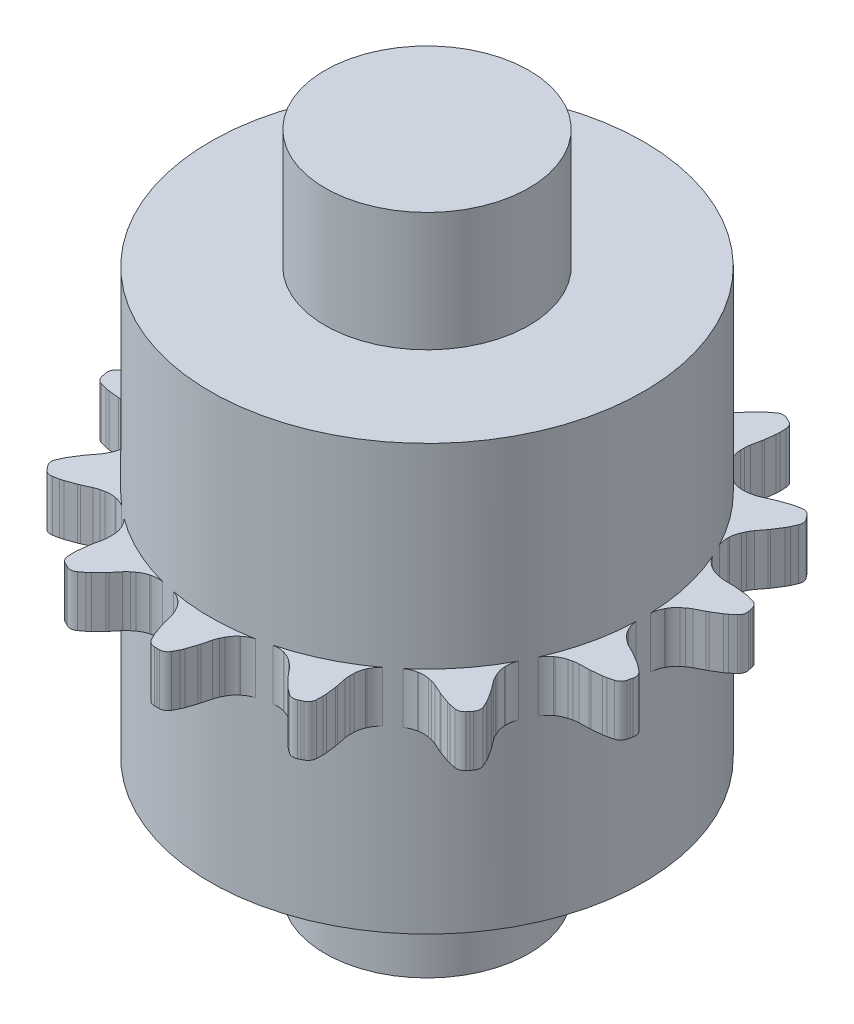
from build123d import *

# Parameters (mm, degrees)
BOSS_EXTRUDE1_DEPTH = 3


with BuildPart() as part:
    # Sketch1 → Revolve1 (revolve)
    with BuildSketch(Plane.XY):
        Polygon((12.74, 25), (12.74, 0), (6, 0), (6, -7), (0, -7), (0, 32), (6, 32), (6, 25), align=None)
    revolve(axis=Axis((0, 0, 0), (0, 1, 0)))

    # Sketch3 → Boss-Extrude1 (add)
    with BuildSketch(Plane(origin=(0, 10.5, 0), x_dir=(-1, 0, 0), z_dir=(0, -1, 0))):
        with BuildLine():
            ThreePointArc((-7.604112547, 10.22179399), (-5.527678836, 11.478343377), (-3.250633724, 12.318318895))
            ThreePointArc((-3.250633724, 12.318318895), (-3.575731316, 12.298335679), (-3.897478234, 12.348998229))
            Line((-3.897478234, 12.348998229), (-3.960120129, 12.365995683))
            ThreePointArc((-3.960120129, 12.365995683), (-4.23545706, 12.470675067), (-4.485027777, 12.627144414))
            Line((-4.485027777, 12.627144414), (-4.670486474, 12.77059005))
            ThreePointArc((-4.670486474, 12.77059005), (-4.793748693, 12.877113397), (-4.904731597, 12.996376103))
            Line((-4.904731597, 12.996376103), (-5.268560327, 13.432630355))
            ThreePointArc((-5.268560327, 13.432630355), (-5.308223076, 13.478285048), (-5.349693923, 13.522303833))
            Line((-5.349693923, 13.522303833), (-5.78239737, 13.963426694))
            ThreePointArc((-5.78239737, 13.963426694), (-5.86446704, 14.041021079), (-5.952142462, 14.112220374))
            Line((-5.952142462, 14.112220374), (-6.241887446, 14.329938852))
            ThreePointArc((-6.241887446, 14.329938852), (-6.494181544, 14.427894494), (-6.760558978, 14.380033419))
            Line((-6.760558978, 14.380033419), (-6.893895698, 14.315321924))
            Line((-6.893895698, 14.315321924), (-7.027623268, 14.251422035))
            ThreePointArc((-7.027623268, 14.251422035), (-7.231126177, 14.073000663), (-7.31184417, 13.814674851))
            Line((-7.31184417, 13.814674851), (-7.322278052, 13.45239785))
            ThreePointArc((-7.322278052, 13.45239785), (-7.321276933, 13.33945841), (-7.311780802, 13.226914451))
            Line((-7.311780802, 13.226914451), (-7.236683248, 12.613577668))
            ThreePointArc((-7.236683248, 12.613577668), (-7.228124627, 12.553709191), (-7.217159669, 12.49423437))
            Line((-7.217159669, 12.49423437), (-7.102925863, 11.937781537))
            ThreePointArc((-7.102925863, 11.937781537), (-7.078879234, 11.776652528), (-7.072448665, 11.613866024))
            Line((-7.072448665, 11.613866024), (-7.075929956, 11.379431684))
            ThreePointArc((-7.075929956, 11.379431684), (-7.109202092, 11.086752399), (-7.199030223, 10.806218789))
            Line((-7.199030223, 10.806218789), (-7.224797661, 10.746645644))
            ThreePointArc((-7.224797661, 10.746645644), (-7.385794006, 10.463506191), (-7.604112547, 10.22179399))
        make_face()
        with BuildLine():
            ThreePointArc((-1.846522974, 12.817115383), (-2.114425274, 12.631869247), (-2.415998476, 12.508818944))
            ThreePointArc((-2.415998476, 12.508818944), (0, 12.74), (2.415998476, 12.508818944))
            ThreePointArc((2.415998476, 12.508818944), (2.114425274, 12.631869247), (1.846522974, 12.817115383))
            Line((1.846522974, 12.817115383), (1.797459496, 12.85960886))
            ThreePointArc((1.797459496, 12.85960886), (1.594808175, 13.073385943), (1.437842233, 13.322644629))
            Line((1.437842233, 13.322644629), (1.332988451, 13.532352195))
            ThreePointArc((1.332988451, 13.532352195), (1.268151776, 13.681807886), (1.219905784, 13.837413549))
            Line((1.219905784, 13.837413549), (1.081391051, 14.388324419))
            ThreePointArc((1.081391051, 14.388324419), (1.065464978, 14.446666897), (1.047200071, 14.504319978))
            Line((1.047200071, 14.504319978), (0.848743772, 15.089500933))
            ThreePointArc((0.848743772, 15.089500933), (0.808468497, 15.195019753), (0.760367887, 15.297209041))
            Line((0.760367887, 15.297209041), (0.593781185, 15.619082249))
            ThreePointArc((0.593781185, 15.619082249), (0.408973417, 15.816803539), (0.148209499, 15.889259038))
            Line((0.148209499, 15.889259038), (0, 15.88880863))
            Line((0, 15.88880863), (-0.148209499, 15.889259038))
            ThreePointArc((-0.148209499, 15.889259038), (-0.408973417, 15.816803539), (-0.593781185, 15.619082249))
            Line((-0.593781185, 15.619082249), (-0.760367887, 15.297209041))
            ThreePointArc((-0.760367887, 15.297209041), (-0.808468497, 15.195019753), (-0.848743772, 15.089500933))
            Line((-0.848743772, 15.089500933), (-1.047200071, 14.504319978))
            ThreePointArc((-1.047200071, 14.504319978), (-1.065464978, 14.446666897), (-1.081391051, 14.388324419))
            Line((-1.081391051, 14.388324419), (-1.219905784, 13.837413549))
            ThreePointArc((-1.219905784, 13.837413549), (-1.268151776, 13.681807886), (-1.332988451, 13.532352195))
            Line((-1.332988451, 13.532352195), (-1.437842233, 13.322644629))
            ThreePointArc((-1.437842233, 13.322644629), (-1.594808175, 13.073385943), (-1.797459496, 12.85960886))
            Line((-1.797459496, 12.85960886), (-1.846522974, 12.817115383))
        make_face()
        with BuildLine():
            ThreePointArc((-11.28613887, 5.910217375), (-9.960533087, 7.943260076), (-8.273438048, 9.688024715))
            ThreePointArc((-8.273438048, 9.688024715), (-8.557670465, 9.5289659), (-8.869536078, 9.435010525))
            Line((-8.869536078, 9.435010525), (-8.933349394, 9.423145402))
            ThreePointArc((-8.933349394, 9.423145402), (-9.22683808, 9.397994051), (-9.519583032, 9.430683385))
            Line((-9.519583032, 9.430683385), (-9.748914273, 9.479455925))
            ThreePointArc((-9.748914273, 9.479455925), (-9.906188443, 9.521948671), (-10.057926733, 9.581246979))
            Line((-10.057926733, 9.581246979), (-10.575008718, 9.816439109))
            ThreePointArc((-10.575008718, 9.816439109), (-10.630552449, 9.840363545), (-10.687015426, 9.862029573))
            Line((-10.687015426, 9.862029573), (-11.268263798, 10.071724548))
            ThreePointArc((-11.268263798, 10.071724548), (-11.375872957, 10.106025979), (-11.485757999, 10.132133387))
            Line((-11.485757999, 10.132133387), (-11.841273716, 10.202575321))
            ThreePointArc((-11.841273716, 10.202575321), (-12.111084205, 10.181363997), (-12.330315837, 10.022665822))
            Line((-12.330315837, 10.022665822), (-12.422370806, 9.906510144))
            Line((-12.422370806, 9.906510144), (-12.51513006, 9.790916117))
            ThreePointArc((-12.51513006, 9.790916117), (-12.621065714, 9.541867412), (-12.581706743, 9.274101673))
            Line((-12.581706743, 9.274101673), (-12.433921246, 8.943174282))
            ThreePointArc((-12.433921246, 8.943174282), (-12.384016683, 8.841853732), (-12.32662997, 8.744575345))
            Line((-12.32662997, 8.744575345), (-11.992852555, 8.224561606))
            ThreePointArc((-11.992852555, 8.224561606), (-11.959165545, 8.174335418), (-11.923481302, 8.125507972))
            Line((-11.923481302, 8.125507972), (-11.579124364, 7.673725484))
            ThreePointArc((-11.579124364, 7.673725484), (-11.487547842, 7.538986705), (-11.411123683, 7.395111252))
            Line((-11.411123683, 7.395111252), (-11.31254297, 7.182382735))
            ThreePointArc((-11.31254297, 7.182382735), (-11.215531346, 6.904251572), (-11.174744724, 6.612524558))
            Line((-11.174744724, 6.612524558), (-11.172112564, 6.547670937))
            ThreePointArc((-11.172112564, 6.547670937), (-11.194315654, 6.222717408), (-11.28613887, 5.910217375))
        make_face()
        with BuildLine():
            ThreePointArc((3.897478234, 12.348998229), (3.575731316, 12.298335679), (3.250633724, 12.318318895))
            ThreePointArc((3.250633724, 12.318318895), (5.527678836, 11.478343377), (7.604112547, 10.22179399))
            ThreePointArc((7.604112547, 10.22179399), (7.385794006, 10.463506191), (7.224797661, 10.746645644))
            Line((7.224797661, 10.746645644), (7.199030223, 10.806218789))
            ThreePointArc((7.199030223, 10.806218789), (7.109202092, 11.086752399), (7.075929956, 11.379431684))
            Line((7.075929956, 11.379431684), (7.072448665, 11.613866024))
            ThreePointArc((7.072448665, 11.613866024), (7.078879234, 11.776652528), (7.102925863, 11.937781537))
            Line((7.102925863, 11.937781537), (7.217159669, 12.49423437))
            ThreePointArc((7.217159669, 12.49423437), (7.228124627, 12.553709191), (7.236683248, 12.613577668))
            Line((7.236683248, 12.613577668), (7.311780802, 13.226914451))
            ThreePointArc((7.311780802, 13.226914451), (7.321276933, 13.33945841), (7.322278052, 13.45239785))
            Line((7.322278052, 13.45239785), (7.31184417, 13.814674851))
            ThreePointArc((7.31184417, 13.814674851), (7.231126177, 14.073000663), (7.027623268, 14.251422035))
            Line((7.027623268, 14.251422035), (6.893895698, 14.315321924))
            Line((6.893895698, 14.315321924), (6.760558978, 14.380033419))
            ThreePointArc((6.760558978, 14.380033419), (6.494181544, 14.427894494), (6.241887446, 14.329938852))
            Line((6.241887446, 14.329938852), (5.952142462, 14.112220374))
            ThreePointArc((5.952142462, 14.112220374), (5.86446704, 14.041021079), (5.78239737, 13.963426694))
            Line((5.78239737, 13.963426694), (5.349693923, 13.522303833))
            ThreePointArc((5.349693923, 13.522303833), (5.308223076, 13.478285048), (5.268560327, 13.432630355))
            Line((5.268560327, 13.432630355), (4.904731597, 12.996376103))
            ThreePointArc((4.904731597, 12.996376103), (4.793748693, 12.877113397), (4.670486474, 12.77059005))
            Line((4.670486474, 12.77059005), (4.485027777, 12.627144414))
            ThreePointArc((4.485027777, 12.627144414), (4.23545706, 12.470675067), (3.960120129, 12.365995683))
            Line((3.960120129, 12.365995683), (3.897478234, 12.348998229))
        make_face()
        with BuildLine():
            ThreePointArc((8.869536078, 9.435010525), (8.557670465, 9.5289659), (8.273438048, 9.688024715))
            ThreePointArc((8.273438048, 9.688024715), (9.960533087, 7.943260076), (11.28613887, 5.910217375))
            ThreePointArc((11.28613887, 5.910217375), (11.194315654, 6.222717407), (11.172112564, 6.547670937))
            Line((11.172112564, 6.547670937), (11.174744724, 6.612524558))
            ThreePointArc((11.174744724, 6.612524558), (11.215531346, 6.904251572), (11.31254297, 7.182382735))
            Line((11.31254297, 7.182382735), (11.411123683, 7.395111252))
            ThreePointArc((11.411123683, 7.395111252), (11.487547842, 7.538986705), (11.579124364, 7.673725484))
            Line((11.579124364, 7.673725484), (11.923481302, 8.125507972))
            ThreePointArc((11.923481302, 8.125507972), (11.959165545, 8.174335418), (11.992852555, 8.224561606))
            Line((11.992852555, 8.224561606), (12.32662997, 8.744575345))
            ThreePointArc((12.32662997, 8.744575345), (12.384016683, 8.841853732), (12.433921246, 8.943174282))
            Line((12.433921246, 8.943174282), (12.581706743, 9.274101673))
            ThreePointArc((12.581706743, 9.274101673), (12.621065714, 9.541867412), (12.51513006, 9.790916117))
            Line((12.51513006, 9.790916117), (12.422370806, 9.906510144))
            Line((12.422370806, 9.906510144), (12.330315837, 10.022665822))
            ThreePointArc((12.330315837, 10.022665822), (12.111084205, 10.181363997), (11.841273716, 10.202575321))
            Line((11.841273716, 10.202575321), (11.485757999, 10.132133387))
            ThreePointArc((11.485757999, 10.132133387), (11.375872957, 10.106025979), (11.268263798, 10.071724548))
            Line((11.268263798, 10.071724548), (10.687015426, 9.862029573))
            ThreePointArc((10.687015426, 9.862029573), (10.630552449, 9.840363545), (10.575008718, 9.816439109))
            Line((10.575008718, 9.816439109), (10.057926733, 9.581246979))
            ThreePointArc((10.057926733, 9.581246979), (9.906188443, 9.521948671), (9.748914273, 9.479455925))
            Line((9.748914273, 9.479455925), (9.519583032, 9.430683385))
            ThreePointArc((9.519583032, 9.430683385), (9.22683808, 9.397994051), (8.933349394, 9.423145402))
            Line((8.933349394, 9.423145402), (8.869536078, 9.435010525))
        make_face()
        with BuildLine():
            ThreePointArc((-12.732806974, 0.428049724), (-12.420581601, 2.834916699), (-11.657586499, 5.138898424))
            ThreePointArc((-11.657586499, 5.138898424), (-11.844658025, 4.87226756), (-12.084873524, 4.652303274))
            Line((-12.084873524, 4.652303274), (-12.137219251, 4.613925607))
            ThreePointArc((-12.137219251, 4.613925607), (-12.390730658, 4.463925055), (-12.668668116, 4.366359852))
            Line((-12.668668116, 4.366359852), (-12.896450037, 4.310799296))
            ThreePointArc((-12.896450037, 4.310799296), (-13.05658608, 4.280845233), (-13.219026127, 4.268434385))
            Line((-13.219026127, 4.268434385), (-13.786946939, 4.255981707))
            ThreePointArc((-13.786946939, 4.255981707), (-13.847370534, 4.253437357), (-13.907642456, 4.248459406))
            Line((-13.907642456, 4.248459406), (-14.522312383, 4.185193834))
            ThreePointArc((-14.522312383, 4.185193834), (-14.634147718, 4.169408491), (-14.7444783, 4.14525312))
            Line((-14.7444783, 4.14525312), (-15.095350503, 4.05446662))
            ThreePointArc((-15.095350503, 4.05446662), (-15.329238105, 3.918289495), (-15.457902423, 3.680186339))
            Line((-15.457902423, 3.680186339), (-15.490443025, 3.535592536))
            Line((-15.490443025, 3.535592536), (-15.523861856, 3.391199183))
            ThreePointArc((-15.523861856, 3.391199183), (-15.511248399, 3.120850297), (-15.359607991, 2.896678919))
            Line((-15.359607991, 2.896678919), (-15.082873845, 2.662645366))
            ThreePointArc((-15.082873845, 2.662645366), (-14.993950048, 2.593011483), (-14.900038897, 2.530265847))
            Line((-14.900038897, 2.530265847), (-14.373690332, 2.206570249))
            ThreePointArc((-14.373690332, 2.206570249), (-14.321547058, 2.175934264), (-14.268211232, 2.147425068))
            Line((-14.268211232, 2.147425068), (-13.761935275, 1.889793987))
            ThreePointArc((-13.761935275, 1.889793987), (-13.620966715, 1.808132105), (-13.489685707, 1.711664002))
            Line((-13.489685707, 1.711664002), (-13.30856811, 1.562774799))
            ThreePointArc((-13.30856811, 1.562774799), (-13.100487067, 1.354279046), (-12.937163983, 1.10913874))
            Line((-12.937163983, 1.10913874), (-12.906653558, 1.051849698))
            ThreePointArc((-12.906653558, 1.051849698), (-12.785665798, 0.749443125), (-12.732806974, 0.428049724))
        make_face()
        with BuildLine():
            ThreePointArc((12.084873524, 4.652303274), (11.844658025, 4.87226756), (11.657586499, 5.138898424))
            ThreePointArc((11.657586499, 5.138898424), (12.420581601, 2.834916699), (12.732806974, 0.428049724))
            ThreePointArc((12.732806974, 0.428049724), (12.785665798, 0.749443125), (12.906653558, 1.051849698))
            Line((12.906653558, 1.051849698), (12.937163983, 1.10913874))
            ThreePointArc((12.937163983, 1.10913874), (13.100487067, 1.354279046), (13.30856811, 1.562774799))
            Line((13.30856811, 1.562774799), (13.489685707, 1.711664002))
            ThreePointArc((13.489685707, 1.711664002), (13.620966715, 1.808132105), (13.761935275, 1.889793987))
            Line((13.761935275, 1.889793987), (14.268211232, 2.147425068))
            ThreePointArc((14.268211232, 2.147425068), (14.321547058, 2.175934264), (14.373690332, 2.206570249))
            Line((14.373690332, 2.206570249), (14.900038897, 2.530265847))
            ThreePointArc((14.900038897, 2.530265847), (14.993950048, 2.593011483), (15.082873845, 2.662645366))
            Line((15.082873845, 2.662645366), (15.359607991, 2.896678919))
            ThreePointArc((15.359607991, 2.896678919), (15.511248399, 3.120850297), (15.523861856, 3.391199183))
            Line((15.523861856, 3.391199183), (15.490443025, 3.535592536))
            Line((15.490443025, 3.535592536), (15.457902423, 3.680186339))
            ThreePointArc((15.457902423, 3.680186339), (15.329238105, 3.918289495), (15.095350503, 4.05446662))
            Line((15.095350503, 4.05446662), (14.7444783, 4.14525312))
            ThreePointArc((14.7444783, 4.14525312), (14.634147719, 4.169408491), (14.522312383, 4.185193834))
            Line((14.522312383, 4.185193834), (13.907642456, 4.248459406))
            ThreePointArc((13.907642456, 4.248459406), (13.847370534, 4.253437357), (13.786946939, 4.255981707))
            Line((13.786946939, 4.255981707), (13.219026127, 4.268434385))
            ThreePointArc((13.219026127, 4.268434385), (13.05658608, 4.280845233), (12.896450037, 4.310799296))
            Line((12.896450037, 4.310799296), (12.668668116, 4.366359852))
            ThreePointArc((12.668668116, 4.366359852), (12.390730658, 4.463925055), (12.137219251, 4.613925607))
            Line((12.137219251, 4.613925607), (12.084873524, 4.652303274))
        make_face()
        with BuildLine():
            ThreePointArc((-11.657586499, -5.138898424), (-12.420581601, -2.834916699), (-12.732806974, -0.428049724))
            ThreePointArc((-12.732806974, -0.428049724), (-12.785665798, -0.749443125), (-12.906653558, -1.051849698))
            Line((-12.906653558, -1.051849698), (-12.937163983, -1.10913874))
            ThreePointArc((-12.937163983, -1.10913874), (-13.100487067, -1.354279046), (-13.30856811, -1.562774799))
            Line((-13.30856811, -1.562774799), (-13.489685707, -1.711664002))
            ThreePointArc((-13.489685707, -1.711664002), (-13.620966715, -1.808132105), (-13.761935275, -1.889793987))
            Line((-13.761935275, -1.889793987), (-14.268211232, -2.147425068))
            ThreePointArc((-14.268211232, -2.147425068), (-14.321547058, -2.175934264), (-14.373690332, -2.206570249))
            Line((-14.373690332, -2.206570249), (-14.900038897, -2.530265847))
            ThreePointArc((-14.900038897, -2.530265847), (-14.993950048, -2.593011483), (-15.082873845, -2.662645366))
            Line((-15.082873845, -2.662645366), (-15.359607991, -2.896678919))
            ThreePointArc((-15.359607991, -2.896678919), (-15.511248399, -3.120850297), (-15.523861856, -3.391199183))
            Line((-15.523861856, -3.391199183), (-15.490443025, -3.535592536))
            Line((-15.490443025, -3.535592536), (-15.457902423, -3.680186339))
            ThreePointArc((-15.457902423, -3.680186339), (-15.329238105, -3.918289495), (-15.095350503, -4.05446662))
            Line((-15.095350503, -4.05446662), (-14.7444783, -4.14525312))
            ThreePointArc((-14.7444783, -4.14525312), (-14.634147718, -4.169408491), (-14.522312383, -4.185193834))
            Line((-14.522312383, -4.185193834), (-13.907642456, -4.248459406))
            ThreePointArc((-13.907642456, -4.248459406), (-13.847370534, -4.253437357), (-13.786946939, -4.255981707))
            Line((-13.786946939, -4.255981707), (-13.219026127, -4.268434385))
            ThreePointArc((-13.219026127, -4.268434385), (-13.05658608, -4.280845233), (-12.896450037, -4.310799296))
            Line((-12.896450037, -4.310799296), (-12.668668116, -4.366359852))
            ThreePointArc((-12.668668116, -4.366359852), (-12.390730658, -4.463925055), (-12.137219251, -4.613925607))
            Line((-12.137219251, -4.613925607), (-12.084873524, -4.652303274))
            ThreePointArc((-12.084873524, -4.652303274), (-11.844658025, -4.87226756), (-11.657586499, -5.138898424))
        make_face()
        with BuildLine():
            ThreePointArc((12.906653558, -1.051849698), (12.785665798, -0.749443125), (12.732806974, -0.428049724))
            ThreePointArc((12.732806974, -0.428049724), (12.420581601, -2.834916699), (11.657586499, -5.138898424))
            ThreePointArc((11.657586499, -5.138898424), (11.844658025, -4.87226756), (12.084873524, -4.652303274))
            Line((12.084873524, -4.652303274), (12.137219251, -4.613925607))
            ThreePointArc((12.137219251, -4.613925607), (12.390730658, -4.463925055), (12.668668116, -4.366359852))
            Line((12.668668116, -4.366359852), (12.896450037, -4.310799296))
            ThreePointArc((12.896450037, -4.310799296), (13.05658608, -4.280845233), (13.219026127, -4.268434385))
            Line((13.219026127, -4.268434385), (13.786946939, -4.255981707))
            ThreePointArc((13.786946939, -4.255981707), (13.847370534, -4.253437357), (13.907642456, -4.248459406))
            Line((13.907642456, -4.248459406), (14.522312383, -4.185193834))
            ThreePointArc((14.522312383, -4.185193834), (14.634147719, -4.169408491), (14.7444783, -4.14525312))
            Line((14.7444783, -4.14525312), (15.095350503, -4.05446662))
            ThreePointArc((15.095350503, -4.05446662), (15.329238105, -3.918289495), (15.457902423, -3.680186339))
            Line((15.457902423, -3.680186339), (15.490443025, -3.535592536))
            Line((15.490443025, -3.535592536), (15.523861856, -3.391199183))
            ThreePointArc((15.523861856, -3.391199183), (15.511248399, -3.120850297), (15.359607991, -2.896678919))
            Line((15.359607991, -2.896678919), (15.082873845, -2.662645366))
            ThreePointArc((15.082873845, -2.662645366), (14.993950048, -2.593011483), (14.900038897, -2.530265847))
            Line((14.900038897, -2.530265847), (14.373690332, -2.206570249))
            ThreePointArc((14.373690332, -2.206570249), (14.321547058, -2.175934264), (14.268211232, -2.147425068))
            Line((14.268211232, -2.147425068), (13.761935275, -1.889793987))
            ThreePointArc((13.761935275, -1.889793987), (13.620966715, -1.808132105), (13.489685707, -1.711664002))
            Line((13.489685707, -1.711664002), (13.30856811, -1.562774799))
            ThreePointArc((13.30856811, -1.562774799), (13.100487067, -1.354279046), (12.937163983, -1.10913874))
            Line((12.937163983, -1.10913874), (12.906653558, -1.051849698))
        make_face()
        with BuildLine():
            ThreePointArc((-8.273438048, -9.688024715), (-9.960533087, -7.943260076), (-11.28613887, -5.910217375))
            ThreePointArc((-11.28613887, -5.910217375), (-11.194315654, -6.222717408), (-11.172112564, -6.547670937))
            Line((-11.172112564, -6.547670937), (-11.174744724, -6.612524558))
            ThreePointArc((-11.174744724, -6.612524558), (-11.215531346, -6.904251572), (-11.31254297, -7.182382735))
            Line((-11.31254297, -7.182382735), (-11.411123683, -7.395111252))
            ThreePointArc((-11.411123683, -7.395111252), (-11.487547842, -7.538986705), (-11.579124364, -7.673725484))
            Line((-11.579124364, -7.673725484), (-11.923481302, -8.125507972))
            ThreePointArc((-11.923481302, -8.125507972), (-11.959165545, -8.174335418), (-11.992852555, -8.224561606))
            Line((-11.992852555, -8.224561606), (-12.32662997, -8.744575345))
            ThreePointArc((-12.32662997, -8.744575345), (-12.384016683, -8.841853732), (-12.433921246, -8.943174282))
            Line((-12.433921246, -8.943174282), (-12.581706743, -9.274101673))
            ThreePointArc((-12.581706743, -9.274101673), (-12.621065714, -9.541867412), (-12.51513006, -9.790916117))
            Line((-12.51513006, -9.790916117), (-12.422370806, -9.906510144))
            Line((-12.422370806, -9.906510144), (-12.330315837, -10.022665822))
            ThreePointArc((-12.330315837, -10.022665822), (-12.111084205, -10.181363997), (-11.841273716, -10.202575321))
            Line((-11.841273716, -10.202575321), (-11.485757999, -10.132133387))
            ThreePointArc((-11.485757999, -10.132133387), (-11.375872957, -10.106025979), (-11.268263798, -10.071724548))
            Line((-11.268263798, -10.071724548), (-10.687015426, -9.862029573))
            ThreePointArc((-10.687015426, -9.862029573), (-10.630552449, -9.840363545), (-10.575008718, -9.816439109))
            Line((-10.575008718, -9.816439109), (-10.057926733, -9.581246979))
            ThreePointArc((-10.057926733, -9.581246979), (-9.906188443, -9.521948671), (-9.748914273, -9.479455925))
            Line((-9.748914273, -9.479455925), (-9.519583032, -9.430683385))
            ThreePointArc((-9.519583032, -9.430683385), (-9.22683808, -9.397994051), (-8.933349394, -9.423145402))
            Line((-8.933349394, -9.423145402), (-8.869536078, -9.435010525))
            ThreePointArc((-8.869536078, -9.435010525), (-8.557670465, -9.5289659), (-8.273438048, -9.688024715))
        make_face()
        with BuildLine():
            ThreePointArc((11.172112564, -6.547670937), (11.194315654, -6.222717407), (11.28613887, -5.910217375))
            ThreePointArc((11.28613887, -5.910217375), (9.960533087, -7.943260076), (8.273438048, -9.688024715))
            ThreePointArc((8.273438048, -9.688024715), (8.557670465, -9.5289659), (8.869536078, -9.435010525))
            Line((8.869536078, -9.435010525), (8.933349394, -9.423145402))
            ThreePointArc((8.933349394, -9.423145402), (9.22683808, -9.397994051), (9.519583032, -9.430683385))
            Line((9.519583032, -9.430683385), (9.748914273, -9.479455925))
            ThreePointArc((9.748914273, -9.479455925), (9.906188443, -9.521948671), (10.057926733, -9.581246979))
            Line((10.057926733, -9.581246979), (10.575008718, -9.816439109))
            ThreePointArc((10.575008718, -9.816439109), (10.630552449, -9.840363545), (10.687015426, -9.862029573))
            Line((10.687015426, -9.862029573), (11.268263798, -10.071724548))
            ThreePointArc((11.268263798, -10.071724548), (11.375872957, -10.106025979), (11.485757999, -10.132133387))
            Line((11.485757999, -10.132133387), (11.841273716, -10.202575321))
            ThreePointArc((11.841273716, -10.202575321), (12.111084205, -10.181363997), (12.330315837, -10.022665822))
            Line((12.330315837, -10.022665822), (12.422370806, -9.906510144))
            Line((12.422370806, -9.906510144), (12.51513006, -9.790916117))
            ThreePointArc((12.51513006, -9.790916117), (12.621065714, -9.541867412), (12.581706743, -9.274101673))
            Line((12.581706743, -9.274101673), (12.433921246, -8.943174282))
            ThreePointArc((12.433921246, -8.943174282), (12.384016683, -8.841853732), (12.32662997, -8.744575345))
            Line((12.32662997, -8.744575345), (11.992852555, -8.224561606))
            ThreePointArc((11.992852555, -8.224561606), (11.959165545, -8.174335418), (11.923481302, -8.125507972))
            Line((11.923481302, -8.125507972), (11.579124364, -7.673725484))
            ThreePointArc((11.579124364, -7.673725484), (11.487547842, -7.538986705), (11.411123683, -7.395111252))
            Line((11.411123683, -7.395111252), (11.31254297, -7.182382735))
            ThreePointArc((11.31254297, -7.182382735), (11.215531346, -6.904251572), (11.174744724, -6.612524558))
            Line((11.174744724, -6.612524558), (11.172112564, -6.547670937))
        make_face()
        with BuildLine():
            ThreePointArc((-3.250633724, -12.318318895), (-5.527678836, -11.478343377), (-7.604112547, -10.22179399))
            ThreePointArc((-7.604112547, -10.22179399), (-7.385794006, -10.463506191), (-7.224797661, -10.746645644))
            Line((-7.224797661, -10.746645644), (-7.199030223, -10.806218789))
            ThreePointArc((-7.199030223, -10.806218789), (-7.109202092, -11.086752399), (-7.075929956, -11.379431684))
            Line((-7.075929956, -11.379431684), (-7.072448665, -11.613866024))
            ThreePointArc((-7.072448665, -11.613866024), (-7.078879234, -11.776652528), (-7.102925863, -11.937781537))
            Line((-7.102925863, -11.937781537), (-7.217159669, -12.49423437))
            ThreePointArc((-7.217159669, -12.49423437), (-7.228124627, -12.553709191), (-7.236683248, -12.613577668))
            Line((-7.236683248, -12.613577668), (-7.311780802, -13.226914451))
            ThreePointArc((-7.311780802, -13.226914451), (-7.321276933, -13.33945841), (-7.322278052, -13.45239785))
            Line((-7.322278052, -13.45239785), (-7.31184417, -13.814674851))
            ThreePointArc((-7.31184417, -13.814674851), (-7.231126177, -14.073000663), (-7.027623268, -14.251422035))
            Line((-7.027623268, -14.251422035), (-6.893895698, -14.315321924))
            Line((-6.893895698, -14.315321924), (-6.760558978, -14.380033419))
            ThreePointArc((-6.760558978, -14.380033419), (-6.494181544, -14.427894494), (-6.241887446, -14.329938852))
            Line((-6.241887446, -14.329938852), (-5.952142462, -14.112220374))
            ThreePointArc((-5.952142462, -14.112220374), (-5.86446704, -14.041021079), (-5.78239737, -13.963426694))
            Line((-5.78239737, -13.963426694), (-5.349693923, -13.522303833))
            ThreePointArc((-5.349693923, -13.522303833), (-5.308223076, -13.478285048), (-5.268560327, -13.432630355))
            Line((-5.268560327, -13.432630355), (-4.904731597, -12.996376103))
            ThreePointArc((-4.904731597, -12.996376103), (-4.793748693, -12.877113397), (-4.670486474, -12.77059005))
            Line((-4.670486474, -12.77059005), (-4.485027777, -12.627144414))
            ThreePointArc((-4.485027777, -12.627144414), (-4.23545706, -12.470675067), (-3.960120129, -12.365995683))
            Line((-3.960120129, -12.365995683), (-3.897478234, -12.348998229))
            ThreePointArc((-3.897478234, -12.348998229), (-3.575731316, -12.298335679), (-3.250633724, -12.318318895))
        make_face()
        with BuildLine():
            ThreePointArc((7.224797661, -10.746645644), (7.385794006, -10.463506191), (7.604112547, -10.22179399))
            ThreePointArc((7.604112547, -10.22179399), (5.527678836, -11.478343377), (3.250633724, -12.318318895))
            ThreePointArc((3.250633724, -12.318318895), (3.575731316, -12.298335679), (3.897478234, -12.348998229))
            Line((3.897478234, -12.348998229), (3.960120129, -12.365995683))
            ThreePointArc((3.960120129, -12.365995683), (4.23545706, -12.470675067), (4.485027777, -12.627144414))
            Line((4.485027777, -12.627144414), (4.670486474, -12.77059005))
            ThreePointArc((4.670486474, -12.77059005), (4.793748693, -12.877113397), (4.904731597, -12.996376103))
            Line((4.904731597, -12.996376103), (5.268560327, -13.432630355))
            ThreePointArc((5.268560327, -13.432630355), (5.308223076, -13.478285048), (5.349693923, -13.522303833))
            Line((5.349693923, -13.522303833), (5.78239737, -13.963426694))
            ThreePointArc((5.78239737, -13.963426694), (5.86446704, -14.041021079), (5.952142462, -14.112220374))
            Line((5.952142462, -14.112220374), (6.241887446, -14.329938852))
            ThreePointArc((6.241887446, -14.329938852), (6.494181544, -14.427894494), (6.760558978, -14.380033419))
            Line((6.760558978, -14.380033419), (6.893895698, -14.315321924))
            Line((6.893895698, -14.315321924), (7.027623268, -14.251422035))
            ThreePointArc((7.027623268, -14.251422035), (7.231126177, -14.073000663), (7.31184417, -13.814674851))
            Line((7.31184417, -13.814674851), (7.322278052, -13.45239785))
            ThreePointArc((7.322278052, -13.45239785), (7.321276933, -13.33945841), (7.311780802, -13.226914451))
            Line((7.311780802, -13.226914451), (7.236683248, -12.613577668))
            ThreePointArc((7.236683248, -12.613577668), (7.228124627, -12.553709191), (7.217159669, -12.49423437))
            Line((7.217159669, -12.49423437), (7.102925863, -11.937781537))
            ThreePointArc((7.102925863, -11.937781537), (7.078879234, -11.776652528), (7.072448665, -11.613866024))
            Line((7.072448665, -11.613866024), (7.075929956, -11.379431684))
            ThreePointArc((7.075929956, -11.379431684), (7.109202092, -11.086752399), (7.199030223, -10.806218789))
            Line((7.199030223, -10.806218789), (7.224797661, -10.746645644))
        make_face()
        with BuildLine():
            ThreePointArc((2.415998476, -12.508818944), (0, -12.74), (-2.415998476, -12.508818944))
            ThreePointArc((-2.415998476, -12.508818944), (-2.114425274, -12.631869247), (-1.846522974, -12.817115383))
            Line((-1.846522974, -12.817115383), (-1.797459496, -12.85960886))
            ThreePointArc((-1.797459496, -12.85960886), (-1.594808175, -13.073385943), (-1.437842233, -13.322644629))
            Line((-1.437842233, -13.322644629), (-1.332988451, -13.532352195))
            ThreePointArc((-1.332988451, -13.532352195), (-1.268151776, -13.681807886), (-1.219905784, -13.837413549))
            Line((-1.219905784, -13.837413549), (-1.081391051, -14.388324419))
            ThreePointArc((-1.081391051, -14.388324419), (-1.065464978, -14.446666897), (-1.047200071, -14.504319978))
            Line((-1.047200071, -14.504319978), (-0.848743772, -15.089500933))
            ThreePointArc((-0.848743772, -15.089500933), (-0.808468497, -15.195019753), (-0.760367887, -15.297209041))
            Line((-0.760367887, -15.297209041), (-0.593781185, -15.619082249))
            ThreePointArc((-0.593781185, -15.619082249), (-0.408973417, -15.816803539), (-0.148209499, -15.889259038))
            Line((-0.148209499, -15.889259038), (0, -15.88880863))
            Line((0, -15.88880863), (0.148209499, -15.889259038))
            ThreePointArc((0.148209499, -15.889259038), (0.408973417, -15.816803539), (0.593781185, -15.619082249))
            Line((0.593781185, -15.619082249), (0.760367887, -15.297209041))
            ThreePointArc((0.760367887, -15.297209041), (0.808468497, -15.195019753), (0.848743772, -15.089500933))
            Line((0.848743772, -15.089500933), (1.047200071, -14.504319978))
            ThreePointArc((1.047200071, -14.504319978), (1.065464978, -14.446666897), (1.081391051, -14.388324419))
            Line((1.081391051, -14.388324419), (1.219905784, -13.837413549))
            ThreePointArc((1.219905784, -13.837413549), (1.268151776, -13.681807886), (1.332988451, -13.532352195))
            Line((1.332988451, -13.532352195), (1.437842234, -13.322644629))
            ThreePointArc((1.437842234, -13.322644629), (1.594808175, -13.073385943), (1.797459496, -12.85960886))
            Line((1.797459496, -12.85960886), (1.846522974, -12.817115383))
            ThreePointArc((1.846522974, -12.817115383), (2.114425274, -12.631869247), (2.415998476, -12.508818944))
        make_face()
    extrude(amount=-BOSS_EXTRUDE1_DEPTH)


solid = part.part
